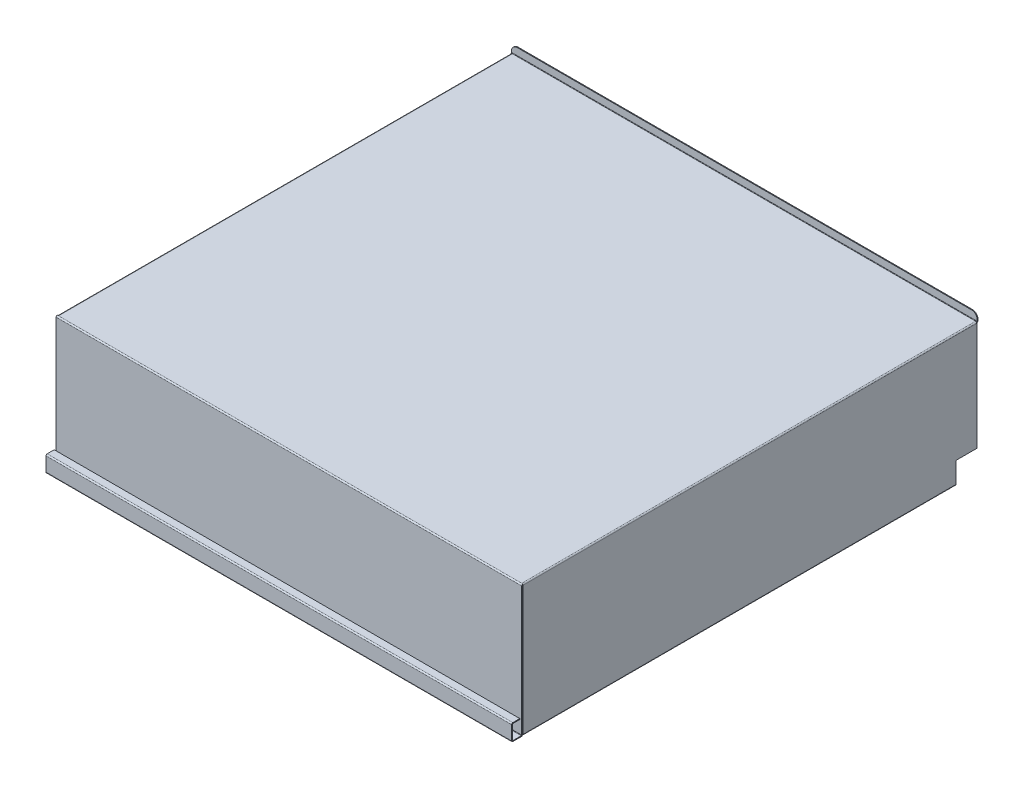
from build123d import *

# Parameters (mm, degrees)
SKETCH_1_W                          = 850
SKETCH_1_H                          = 833
SM_BASE_FLANGE_1_DEPTH              = 1.5
SM_EDGE_FLANGE_1_STRIP_W            = 7.4732
SM_EDGE_FLANGE_1_STRIP_H            = 1.5
SM_EDGE_FLANGE_1_STRIP_CUT_DEPTH    = 850
SM_EDGE_FLANGE_1_DEPTH              = 850
SM_EDGE_FLANGE_3_STRIP_W            = 7.4732
SM_EDGE_FLANGE_3_STRIP_H            = 1.5
SM_EDGE_FLANGE_3_STRIP_CUT_DEPTH    = 850
SM_EDGE_FLANGE_3_DEPTH              = 850
SM_EDGE_FLANGE_4_STRIP_W            = 7.4732
SM_EDGE_FLANGE_4_STRIP_H            = 1.5
SM_EDGE_FLANGE_4_STRIP_CUT_DEPTH    = 850
SM_EDGE_FLANGE_4_DEPTH              = 850
SM_EDGE_FLANGE_7_STRIP_W            = 7.4732
SM_EDGE_FLANGE_7_STRIP_H            = 1.5
SM_EDGE_FLANGE_7_STRIP_CUT_DEPTH    = 828.5268
SM_EDGE_FLANGE_7_STRIP_2_W          = 7.4732
SM_EDGE_FLANGE_7_STRIP_2_H          = 1.5
SM_EDGE_FLANGE_7_STRIP_CUT_2_DEPTH  = 828.5268
SM_EDGE_FLANGE_7_DEPTH              = 828.5268
SM_EDGE_FLANGE_7_FLAT_DEPTH         = 1.5
SM_EDGE_FLANGE_7_BEND_DEPTH         = 828.5268
SM_EDGE_FLANGE_7_FLAT_2_DEPTH       = 1.5
SM_EDGE_FLANGE_8_STRIP_W            = 7.4732
SM_EDGE_FLANGE_8_STRIP_H            = 1.5
SM_EDGE_FLANGE_8_STRIP_CUT_DEPTH    = 790.5268
SM_EDGE_FLANGE_8_STRIP_2_W          = 7.4732
SM_EDGE_FLANGE_8_STRIP_2_H          = 1.5
SM_EDGE_FLANGE_8_STRIP_CUT_2_DEPTH  = 790.5268
SM_EDGE_FLANGE_8_DEPTH              = 790.5268
SM_EDGE_FLANGE_8_BEND_DEPTH         = 790.5268
SM_EDGE_FLANGE_9_STRIP_W            = 7.4732
SM_EDGE_FLANGE_9_STRIP_H            = 1.5
SM_EDGE_FLANGE_9_STRIP_CUT_DEPTH    = 790.5268
SM_EDGE_FLANGE_9_STRIP_2_W          = 7.4732
SM_EDGE_FLANGE_9_STRIP_2_H          = 1.5
SM_EDGE_FLANGE_9_STRIP_CUT_2_DEPTH  = 790.5268
SM_EDGE_FLANGE_9_DEPTH              = 790.5268
SM_EDGE_FLANGE_9_BEND_DEPTH         = 790.5268
FILLET_1_R                          = 10
SKETCH_56_R                         = 3
EXTRUDE_1_DEPTH                     = 10
SM_EDGE_FLANGE_10_STRIP_W           = 7.4732
SM_EDGE_FLANGE_10_STRIP_H           = 1.5
SM_EDGE_FLANGE_10_STRIP_CUT_DEPTH   = 850
SM_EDGE_FLANGE_10_DEPTH             = 850
SM_EDGE_FLANGE_11_STRIP_W           = 7.4732
SM_EDGE_FLANGE_11_STRIP_H           = 1.5
SM_EDGE_FLANGE_11_STRIP_CUT_DEPTH   = 850
SM_EDGE_FLANGE_11_DEPTH             = 850
SM_EDGE_FLANGE_12_STRIP_W           = 7.4732
SM_EDGE_FLANGE_12_STRIP_H           = 1.5
SM_EDGE_FLANGE_12_STRIP_CUT_DEPTH   = 790.5268
SM_EDGE_FLANGE_12_STRIP_2_W         = 7.4732
SM_EDGE_FLANGE_12_STRIP_2_H         = 1.5
SM_EDGE_FLANGE_12_STRIP_CUT_2_DEPTH = 790.5268
SM_EDGE_FLANGE_12_DEPTH             = 790.5268
SM_EDGE_FLANGE_12_BEND_DEPTH        = 790.5268


# Sheet-metal steps are written as plain solids
with BuildPart() as part:
    # Sketch 1 → 基体-法兰1 (new body)
    with BuildSketch(Plane(origin=(0, 0, 0), x_dir=(1, 0, 0), z_dir=(0, 1, 0))):
        Rectangle(SKETCH_1_W, SKETCH_1_H)
    extrude(amount=-SM_BASE_FLANGE_1_DEPTH)

    # 边线-法兰1 strip (across the edge) → 边线-法兰1 strip cut (cut)
    with BuildSketch(Plane(origin=(425, 0, -416.5), x_dir=(0, 0, 1), z_dir=(-1, 0, 0))):
        with Locations((-1.5, -0.75)):
            Rectangle(SM_EDGE_FLANGE_1_STRIP_W, SM_EDGE_FLANGE_1_STRIP_H)
    extrude(amount=SM_EDGE_FLANGE_1_STRIP_CUT_DEPTH, mode=Mode.SUBTRACT)

    # 边线-法兰1 section (across the edge) → 边线-法兰1 (add)
    with BuildSketch(Plane(origin=(425, 0, -416.5), x_dir=(0, 0, 1), z_dir=(-1, 0, 0))):
        with BuildLine():
            Line((0, 0.7366), (0, 13.5))
            Line((0, 13.5), (1.5, 13.5))
            Line((1.5, 13.5), (1.5, 0.7366))
            ThreePointArc((1.5, 0.7366), (1.715745145, 0.215745145), (2.2366, 0))
            Line((2.2366, 0), (2.2366, -1.5))
            ThreePointArc((2.2366, -1.5), (0.655084973, -0.844915027), (0, 0.7366))
        make_face()
    extrude(amount=SM_EDGE_FLANGE_1_DEPTH)

    # 边线-法兰3 strip (across the edge) → 边线-法兰3 strip cut (cut)
    with BuildSketch(Plane(origin=(425, -1.5, 416.5), x_dir=(0, 0, -1), z_dir=(-1, 0, 0))):
        with Locations((-1.5, -0.75)):
            Rectangle(SM_EDGE_FLANGE_3_STRIP_W, SM_EDGE_FLANGE_3_STRIP_H)
    extrude(amount=SM_EDGE_FLANGE_3_STRIP_CUT_DEPTH, mode=Mode.SUBTRACT)

    # 边线-法兰3 section (across the edge) → 边线-法兰3 (add)
    with BuildSketch(Plane(origin=(425, -1.5, 416.5), x_dir=(0, 0, -1), z_dir=(-1, 0, 0))):
        with BuildLine():
            Line((0, 0.7366), (0, 238.5))
            Line((0, 238.5), (1.5, 238.5))
            Line((1.5, 238.5), (1.5, 0.7366))
            ThreePointArc((1.5, 0.7366), (1.715745145, 0.215745145), (2.2366, 0))
            Line((2.2366, 0), (2.2366, -1.5))
            ThreePointArc((2.2366, -1.5), (0.655084973, -0.844915027), (0, 0.7366))
        make_face()
    extrude(amount=SM_EDGE_FLANGE_3_DEPTH)

    # 边线-法兰4 strip (across the edge) → 边线-法兰4 strip cut (cut)
    with BuildSketch(Plane(origin=(-425, -240, 416.5), x_dir=(0, 1, 0), z_dir=(1, 0, 0))):
        with Locations((-1.5, -0.75)):
            Rectangle(SM_EDGE_FLANGE_4_STRIP_W, SM_EDGE_FLANGE_4_STRIP_H)
    extrude(amount=SM_EDGE_FLANGE_4_STRIP_CUT_DEPTH, mode=Mode.SUBTRACT)

    # 边线-法兰4 section (across the edge) → 边线-法兰4 (add)
    with BuildSketch(Plane(origin=(-425, -240, 416.5), x_dir=(0, 1, 0), z_dir=(1, 0, 0))):
        with BuildLine():
            Line((0, 0.7366), (0, 18.5))
            Line((0, 18.5), (1.5, 18.5))
            Line((1.5, 18.5), (1.5, 0.7366))
            ThreePointArc((1.5, 0.7366), (1.715745145, 0.215745145), (2.2366, 0))
            Line((2.2366, 0), (2.2366, -1.5))
            ThreePointArc((2.2366, -1.5), (0.655084973, -0.844915027), (0, 0.7366))
        make_face()
    extrude(amount=SM_EDGE_FLANGE_4_DEPTH)

    # 边线-法兰7 strip (across the edge) → 边线-法兰7 strip cut (cut)
    with BuildSketch(Plane(origin=(-425, -1.5, 414.2634), x_dir=(1, 0, 0), z_dir=(0, 0, -1))):
        with Locations((-1.5, -0.75)):
            Rectangle(SM_EDGE_FLANGE_7_STRIP_W, SM_EDGE_FLANGE_7_STRIP_H)
    extrude(amount=SM_EDGE_FLANGE_7_STRIP_CUT_DEPTH, mode=Mode.SUBTRACT)

    # 边线-法兰7 strip 2 (across the edge) → 边线-法兰7 strip cut 2 (cut)
    with BuildSketch(Plane(origin=(425, -1.5, -414.2634), x_dir=(-1, 0, 0), z_dir=(0, 0, 1))):
        with Locations((-1.5, -0.75)):
            Rectangle(SM_EDGE_FLANGE_7_STRIP_2_W, SM_EDGE_FLANGE_7_STRIP_2_H)
    extrude(amount=SM_EDGE_FLANGE_7_STRIP_CUT_2_DEPTH, mode=Mode.SUBTRACT)

    # 边线-法兰7 bend section (across the edge) → 边线-法兰7 (add)
    with BuildSketch(Plane(origin=(-425, -1.5, 414.2634), x_dir=(1, 0, 0), z_dir=(0, 0, -1))):
        with BuildLine():
            Line((0, 0.7366), (1.5, 0.7366))
            ThreePointArc((1.5, 0.7366), (1.715745145, 0.215745145), (2.2366, 0))
            Line((2.2366, 0), (2.2366, -1.5))
            ThreePointArc((2.2366, -1.5), (0.655084973, -0.844915027), (0, 0.7366))
        make_face()
    extrude(amount=SM_EDGE_FLANGE_7_DEPTH)

    # 边线-法兰7 profile (on flange) → 边线-法兰7 flat (add)
    with BuildSketch(Plane(origin=(-425, -1.5, 0), x_dir=(0, 0, -1), z_dir=(-1, 0, 0))):
        Polygon((414.2634, 0.7366), (414.2634, 198.5), (376.2634, 198.5), (376.2634, 238.5), (-414.2634, 238.5), (-414.2634, 0.7366), align=None)
    extrude(amount=-SM_EDGE_FLANGE_7_FLAT_DEPTH)

    # 边线-法兰7 bend section 2 (across the edge) → 边线-法兰7 bend (add)
    with BuildSketch(Plane(origin=(425, -1.5, -414.2634), x_dir=(-1, 0, 0), z_dir=(0, 0, 1))):
        with BuildLine():
            Line((0, 0.7366), (1.5, 0.7366))
            ThreePointArc((1.5, 0.7366), (1.715745145, 0.215745145), (2.2366, 0))
            Line((2.2366, 0), (2.2366, -1.5))
            ThreePointArc((2.2366, -1.5), (0.655084973, -0.844915027), (0, 0.7366))
        make_face()
    extrude(amount=SM_EDGE_FLANGE_7_BEND_DEPTH)

    # 边线-法兰7 profile 2 (on flange) → 边线-法兰7 flat 2 (add)
    with BuildSketch(Plane(origin=(425, -1.5, 0), x_dir=(0, 0, 1), z_dir=(1, 0, 0))):
        Polygon((414.2634, 0.7366), (414.2634, 238.5), (-376.2634, 238.5), (-376.2634, 198.5), (-414.2634, 198.5), (-414.2634, 0.7366), align=None)
    extrude(amount=-SM_EDGE_FLANGE_7_FLAT_2_DEPTH)

    # 边线-法兰8 strip (across the edge) → 边线-法兰8 strip cut (cut)
    with BuildSketch(Plane(origin=(423.5, -240, -376.2634), x_dir=(0, 1, 0), z_dir=(0, 0, 1))):
        with Locations((-1.5, -0.75)):
            Rectangle(SM_EDGE_FLANGE_8_STRIP_W, SM_EDGE_FLANGE_8_STRIP_H)
    extrude(amount=SM_EDGE_FLANGE_8_STRIP_CUT_DEPTH, mode=Mode.SUBTRACT)

    # 边线-法兰8 strip 2 (across the edge) → 边线-法兰8 strip cut 2 (cut)
    with BuildSketch(Plane(origin=(-423.5, -240, 414.2634), x_dir=(0, 1, 0), z_dir=(0, 0, -1))):
        with Locations((-1.5, -0.75)):
            Rectangle(SM_EDGE_FLANGE_8_STRIP_2_W, SM_EDGE_FLANGE_8_STRIP_2_H)
    extrude(amount=SM_EDGE_FLANGE_8_STRIP_CUT_2_DEPTH, mode=Mode.SUBTRACT)

    # 边线-法兰8 section (across the edge) → 边线-法兰8 (add)
    with BuildSketch(Plane(origin=(423.5, -240, -376.2634), x_dir=(0, 1, 0), z_dir=(0, 0, 1))):
        with BuildLine():
            Line((0, 0.7366), (0, 13.5))
            Line((0, 13.5), (1.5, 13.5))
            Line((1.5, 13.5), (1.5, 0.7366))
            ThreePointArc((1.5, 0.7366), (1.715745145, 0.215745145), (2.2366, 0))
            Line((2.2366, 0), (2.2366, -1.5))
            ThreePointArc((2.2366, -1.5), (0.655084973, -0.844915027), (0, 0.7366))
        make_face()
    extrude(amount=SM_EDGE_FLANGE_8_DEPTH)

    # 边线-法兰8 section 2 (across the edge) → 边线-法兰8 bend (add)
    with BuildSketch(Plane(origin=(-423.5, -240, 414.2634), x_dir=(0, 1, 0), z_dir=(0, 0, -1))):
        with BuildLine():
            Line((0, 0.7366), (0, 13.5))
            Line((0, 13.5), (1.5, 13.5))
            Line((1.5, 13.5), (1.5, 0.7366))
            ThreePointArc((1.5, 0.7366), (1.715745145, 0.215745145), (2.2366, 0))
            Line((2.2366, 0), (2.2366, -1.5))
            ThreePointArc((2.2366, -1.5), (0.655084973, -0.844915027), (0, 0.7366))
        make_face()
    extrude(amount=SM_EDGE_FLANGE_8_BEND_DEPTH)

    # 边线-法兰9 strip (across the edge) → 边线-法兰9 strip cut (cut)
    with BuildSketch(Plane(origin=(410, -238.5, -376.2634), x_dir=(1, 0, 0), z_dir=(0, 0, 1))):
        with Locations((-1.5, -0.75)):
            Rectangle(SM_EDGE_FLANGE_9_STRIP_W, SM_EDGE_FLANGE_9_STRIP_H)
    extrude(amount=SM_EDGE_FLANGE_9_STRIP_CUT_DEPTH, mode=Mode.SUBTRACT)

    # 边线-法兰9 strip 2 (across the edge) → 边线-法兰9 strip cut 2 (cut)
    with BuildSketch(Plane(origin=(-410, -238.5, 414.2634), x_dir=(-1, 0, 0), z_dir=(0, 0, -1))):
        with Locations((-1.5, -0.75)):
            Rectangle(SM_EDGE_FLANGE_9_STRIP_2_W, SM_EDGE_FLANGE_9_STRIP_2_H)
    extrude(amount=SM_EDGE_FLANGE_9_STRIP_CUT_2_DEPTH, mode=Mode.SUBTRACT)

    # 边线-法兰9 section (across the edge) → 边线-法兰9 (add)
    with BuildSketch(Plane(origin=(410, -238.5, -376.2634), x_dir=(1, 0, 0), z_dir=(0, 0, 1))):
        with BuildLine():
            Line((0, 0.7366), (0, 13.5))
            Line((0, 13.5), (1.5, 13.5))
            Line((1.5, 13.5), (1.5, 0.7366))
            ThreePointArc((1.5, 0.7366), (1.715745145, 0.215745145), (2.2366, 0))
            Line((2.2366, 0), (2.2366, -1.5))
            ThreePointArc((2.2366, -1.5), (0.655084973, -0.844915027), (0, 0.7366))
        make_face()
    extrude(amount=SM_EDGE_FLANGE_9_DEPTH)

    # 边线-法兰9 section 2 (across the edge) → 边线-法兰9 bend (add)
    with BuildSketch(Plane(origin=(-410, -238.5, 414.2634), x_dir=(-1, 0, 0), z_dir=(0, 0, -1))):
        with BuildLine():
            Line((0, 0.7366), (0, 13.5))
            Line((0, 13.5), (1.5, 13.5))
            Line((1.5, 13.5), (1.5, 0.7366))
            ThreePointArc((1.5, 0.7366), (1.715745145, 0.215745145), (2.2366, 0))
            Line((2.2366, 0), (2.2366, -1.5))
            ThreePointArc((2.2366, -1.5), (0.655084973, -0.844915027), (0, 0.7366))
        make_face()
    extrude(amount=SM_EDGE_FLANGE_9_BEND_DEPTH)

    # 圆角1
    fillet_1_edges = [part.edges().sort_by_distance(p)[0] for p in [
        (425, 13.5, -415.75),
        (-425, 13.5, -415.75),
    ]]
    fillet(fillet_1_edges, radius=FILLET_1_R)

    # 草图56 → 凸台-拉伸1 (add)
    with BuildSketch(Plane.XZ.offset(1.5)):
        with Locations(Location((375, -381.25, 0), (0, 0, 90))):
            Circle(SKETCH_56_R)
        with Locations(Location((250, -381.25, 0), (0, 0, 90))):
            Circle(SKETCH_56_R)
        with Locations(Location((125, -381.25, 0), (0, 0, 90))):
            Circle(SKETCH_56_R)
        with Locations(Location((0, -381.25, 0), (0, 0, 90))):
            Circle(SKETCH_56_R)
        with Locations(Location((-125, -381.25, 0), (0, 0, 90))):
            Circle(SKETCH_56_R)
        with Locations(Location((-250, -381.25, 0), (0, 0, 90))):
            Circle(SKETCH_56_R)
        with Locations(Location((-375, -381.25, 0), (0, 0, 90))):
            Circle(SKETCH_56_R)
        with Locations(Location((375, 379.75, 0), (0, 0, 90))):
            Circle(SKETCH_56_R)
        with Locations(Location((250, 379.75, 0), (0, 0, 90))):
            Circle(SKETCH_56_R)
        with Locations(Location((125, 379.75, 0), (0, 0, 90))):
            Circle(SKETCH_56_R)
        with Locations(Location((0, 379.75, 0), (0, 0, 90))):
            Circle(SKETCH_56_R)
        with Locations(Location((-125, 379.75, 0), (0, 0, 90))):
            Circle(SKETCH_56_R)
        with Locations(Location((-250, 379.75, 0), (0, 0, 90))):
            Circle(SKETCH_56_R)
        with Locations(Location((-375, 379.75, 0), (0, 0, 90))):
            Circle(SKETCH_56_R)
    extrude(amount=EXTRUDE_1_DEPTH)

    # 边线-法兰10 strip (across the edge) → 边线-法兰10 strip cut (cut)
    with BuildSketch(Plane(origin=(-425, -238.5, 435), x_dir=(0, 0, -1), z_dir=(1, 0, 0))):
        with Locations((-1.5, -0.75)):
            Rectangle(SM_EDGE_FLANGE_10_STRIP_W, SM_EDGE_FLANGE_10_STRIP_H)
    extrude(amount=SM_EDGE_FLANGE_10_STRIP_CUT_DEPTH, mode=Mode.SUBTRACT)

    # 边线-法兰10 section (across the edge) → 边线-法兰10 (add)
    with BuildSketch(Plane(origin=(-425, -238.5, 435), x_dir=(0, 0, -1), z_dir=(1, 0, 0))):
        with BuildLine():
            Line((0, 0.7366), (0, 28.5))
            Line((0, 28.5), (1.5, 28.5))
            Line((1.5, 28.5), (1.5, 0.7366))
            ThreePointArc((1.5, 0.7366), (1.715745145, 0.215745145), (2.2366, 0))
            Line((2.2366, 0), (2.2366, -1.5))
            ThreePointArc((2.2366, -1.5), (0.655084973, -0.844915027), (0, 0.7366))
        make_face()
    extrude(amount=SM_EDGE_FLANGE_10_DEPTH)

    # 边线-法兰11 strip (across the edge) → 边线-法兰11 strip cut (cut)
    with BuildSketch(Plane(origin=(-425, -210, 433.5), x_dir=(0, -1, 0), z_dir=(1, 0, 0))):
        with Locations((-1.5, -0.75)):
            Rectangle(SM_EDGE_FLANGE_11_STRIP_W, SM_EDGE_FLANGE_11_STRIP_H)
    extrude(amount=SM_EDGE_FLANGE_11_STRIP_CUT_DEPTH, mode=Mode.SUBTRACT)

    # 边线-法兰11 section (across the edge) → 边线-法兰11 (add)
    with BuildSketch(Plane(origin=(-425, -210, 433.5), x_dir=(0, -1, 0), z_dir=(1, 0, 0))):
        with BuildLine():
            Line((0, 0.7366), (0, 13.5))
            Line((0, 13.5), (1.5, 13.5))
            Line((1.5, 13.5), (1.5, 0.7366))
            ThreePointArc((1.5, 0.7366), (1.715745145, 0.215745145), (2.2366, 0))
            Line((2.2366, 0), (2.2366, -1.5))
            ThreePointArc((2.2366, -1.5), (0.655084973, -0.844915027), (0, 0.7366))
        make_face()
    extrude(amount=SM_EDGE_FLANGE_11_DEPTH)

    # 边线-法兰12 strip (across the edge) → 边线-法兰12 strip cut (cut)
    with BuildSketch(Plane(origin=(411.5, -225, -376.2634), x_dir=(0, -1, 0), z_dir=(0, 0, 1))):
        with Locations((-1.5, -0.75)):
            Rectangle(SM_EDGE_FLANGE_12_STRIP_W, SM_EDGE_FLANGE_12_STRIP_H)
    extrude(amount=SM_EDGE_FLANGE_12_STRIP_CUT_DEPTH, mode=Mode.SUBTRACT)

    # 边线-法兰12 strip 2 (across the edge) → 边线-法兰12 strip cut 2 (cut)
    with BuildSketch(Plane(origin=(-411.5, -225, 414.2634), x_dir=(0, -1, 0), z_dir=(0, 0, -1))):
        with Locations((-1.5, -0.75)):
            Rectangle(SM_EDGE_FLANGE_12_STRIP_2_W, SM_EDGE_FLANGE_12_STRIP_2_H)
    extrude(amount=SM_EDGE_FLANGE_12_STRIP_CUT_2_DEPTH, mode=Mode.SUBTRACT)

    # 边线-法兰12 section (across the edge) → 边线-法兰12 (add)
    with BuildSketch(Plane(origin=(411.5, -225, -376.2634), x_dir=(0, -1, 0), z_dir=(0, 0, 1))):
        with BuildLine():
            Line((0, 0.7366), (0, 11.5))
            Line((0, 11.5), (1.5, 11.5))
            Line((1.5, 11.5), (1.5, 0.7366))
            ThreePointArc((1.5, 0.7366), (1.715745145, 0.215745145), (2.2366, 0))
            Line((2.2366, 0), (2.2366, -1.5))
            ThreePointArc((2.2366, -1.5), (0.655084973, -0.844915027), (0, 0.7366))
        make_face()
    extrude(amount=SM_EDGE_FLANGE_12_DEPTH)

    # 边线-法兰12 section 2 (across the edge) → 边线-法兰12 bend (add)
    with BuildSketch(Plane(origin=(-411.5, -225, 414.2634), x_dir=(0, -1, 0), z_dir=(0, 0, -1))):
        with BuildLine():
            Line((0, 0.7366), (0, 11.5))
            Line((0, 11.5), (1.5, 11.5))
            Line((1.5, 11.5), (1.5, 0.7366))
            ThreePointArc((1.5, 0.7366), (1.715745145, 0.215745145), (2.2366, 0))
            Line((2.2366, 0), (2.2366, -1.5))
            ThreePointArc((2.2366, -1.5), (0.655084973, -0.844915027), (0, 0.7366))
        make_face()
    extrude(amount=SM_EDGE_FLANGE_12_BEND_DEPTH)


solid = part.part
